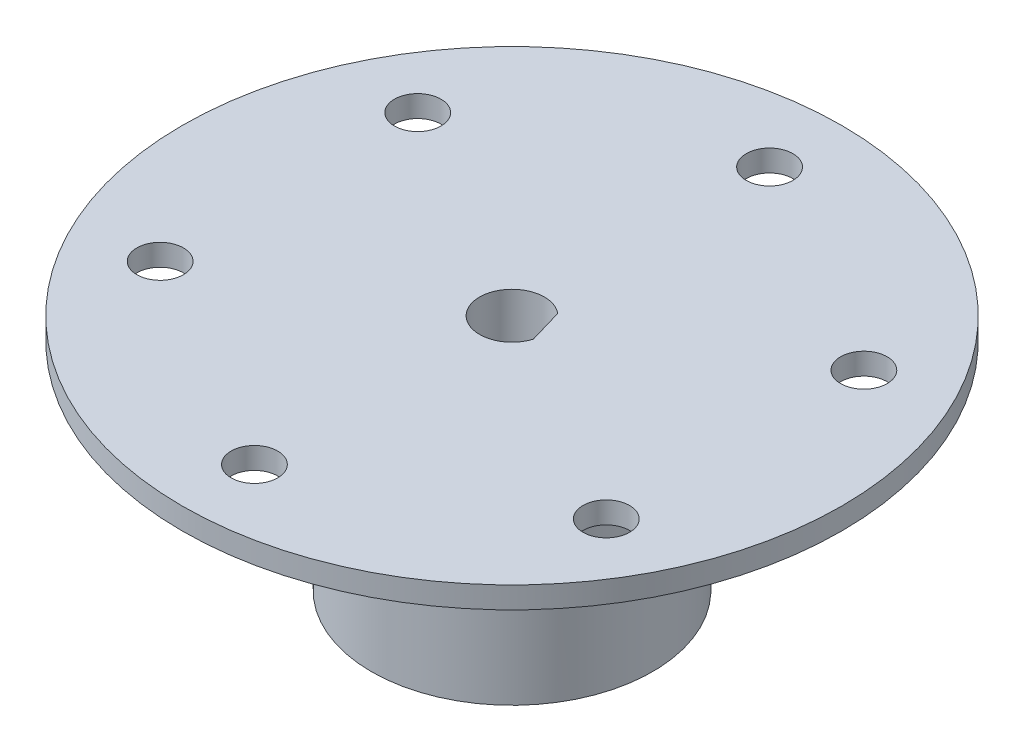
from build123d import *

# Parameters (mm, degrees)
SKETCH1_R           = 30.48
SKETCH1_R_2         = 2.15265
BOSS_EXTRUDE1_DEPTH = 2
CUT_EXTRUDE1_DEPTH  = 10
SKETCH3_R           = 13
BOSS_EXTRUDE2_DEPTH = 20


with BuildPart() as part:
    # Sketch1 → Boss-Extrude1 (new body)
    with BuildSketch(Plane(origin=(0, 0, 0), x_dir=(1, 0, 0), z_dir=(0, 1, 0))):
        Circle(SKETCH1_R)
        with Locations((0, -23.8125)):
            Circle(SKETCH1_R_2, mode=Mode.SUBTRACT)
        with Locations((20.622229928, -11.90625)):
            Circle(SKETCH1_R_2, mode=Mode.SUBTRACT)
        with Locations((20.622229928, 11.90625)):
            Circle(SKETCH1_R_2, mode=Mode.SUBTRACT)
        with Locations((0, 23.8125)):
            Circle(SKETCH1_R_2, mode=Mode.SUBTRACT)
        with Locations((-20.622229928, 11.90625)):
            Circle(SKETCH1_R_2, mode=Mode.SUBTRACT)
        with Locations((-20.622229928, -11.90625)):
            Circle(SKETCH1_R_2, mode=Mode.SUBTRACT)
    extrude(amount=BOSS_EXTRUDE1_DEPTH)

    # Sketch2 → Cut-Extrude1 (cut)
    with BuildSketch(Plane(origin=(0, 2, 0), x_dir=(1, 0, 0), z_dir=(0, 1, 0))):
        with BuildLine():
            ThreePointArc((1.93204455, 2.295038966), (-2.879237228, -0.842610814), (2.864533851, -0.8913169))
            Line((2.864533851, -0.8913169), (1.93204455, 2.295038966))
        make_face()
    extrude(amount=-CUT_EXTRUDE1_DEPTH, mode=Mode.SUBTRACT)

    # Sketch3 → Boss-Extrude2 (add)
    with BuildSketch(Plane.XZ):
        Circle(SKETCH3_R)
        with BuildLine():
            ThreePointArc((1.93204455, -2.295038966), (-2.879237228, 0.842610814), (2.864533851, 0.8913169))
            Line((2.864533851, 0.8913169), (1.93204455, -2.295038966))
        make_face(mode=Mode.SUBTRACT)
    extrude(amount=BOSS_EXTRUDE2_DEPTH)


solid = part.part
